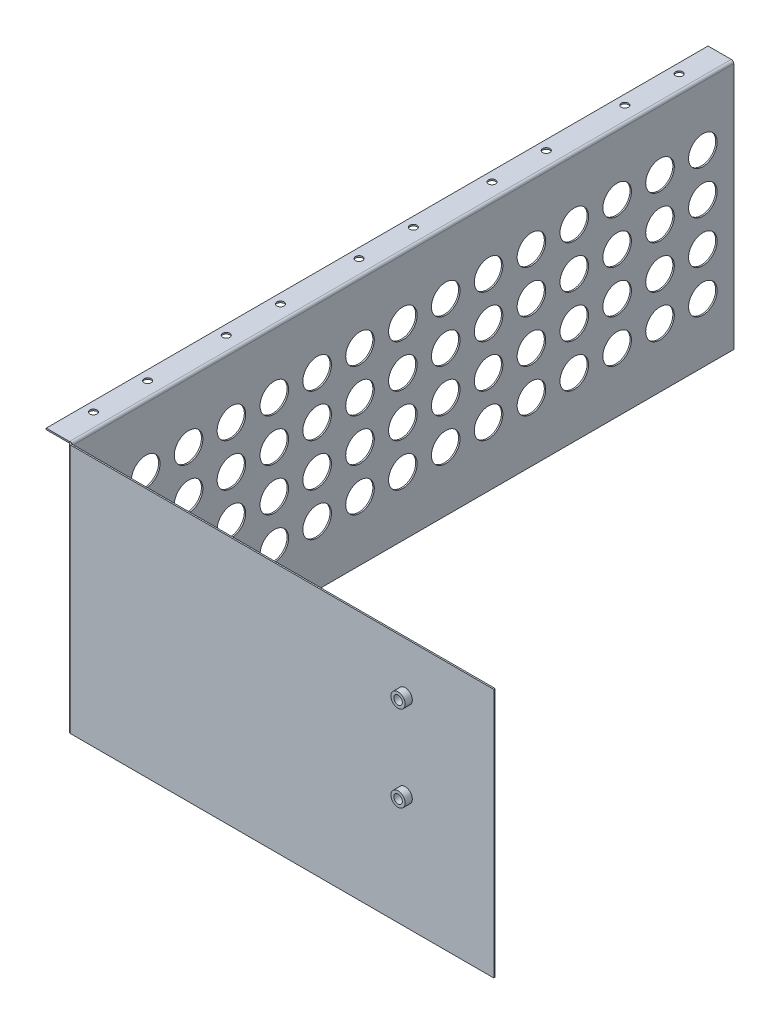
from build123d import *

# Parameters (mm, degrees)
SKETCH1_W                    = 298
SKETCH1_H                    = 175
BASE_FLANGE1_DEPTH           = 1
EDGE_FLANGE1_STRIP_W         = 5.4732
EDGE_FLANGE1_STRIP_H         = 1
EDGE_FLANGE1_STRIP_CUT_DEPTH = 175
EDGE_FLANGE1_DEPTH           = 175
EDGE_FLANGE2_STRIP_W         = 5.4732
EDGE_FLANGE2_STRIP_H         = 1
EDGE_FLANGE2_STRIP_CUT_DEPTH = 463.2634
EDGE_FLANGE2_DEPTH           = 463.2634
SKETCH21_R                   = 5
SKETCH21_R_2                 = 3
BOSS_EXTRUDE2_DEPTH          = 5
SKETCH22_R                   = 10
CUT_EXTRUDE1_DEPTH           = 10
SKETCH24_R                   = 2.5
CUT_EXTRUDE2_DEPTH           = 1


# Sheet-metal steps are written as plain solids
with BuildPart() as part:
    # Sketch1 → Base-Flange1 (new body)
    with BuildSketch(Plane.XY):
        Rectangle(SKETCH1_W, SKETCH1_H)
    extrude(amount=-BASE_FLANGE1_DEPTH)

    # Edge-Flange1 strip (across the edge) → Edge-Flange1 strip cut (cut)
    with BuildSketch(Plane(origin=(-149, -87.5, -1), x_dir=(1, 0, 0), z_dir=(0, 1, 0))):
        with Locations((-1, -0.5)):
            Rectangle(EDGE_FLANGE1_STRIP_W, EDGE_FLANGE1_STRIP_H)
    extrude(amount=EDGE_FLANGE1_STRIP_CUT_DEPTH, mode=Mode.SUBTRACT)

    # Edge-Flange1 section (across the edge) → Edge-Flange1 (add)
    with BuildSketch(Plane(origin=(-149, -87.5, -1), x_dir=(1, 0, 0), z_dir=(0, 1, 0))):
        with BuildLine():
            Line((0, 0.7366), (0, 464))
            Line((0, 464), (1, 464))
            Line((1, 464), (1, 0.7366))
            ThreePointArc((1, 0.7366), (1.215745145, 0.215745145), (1.7366, 0))
            Line((1.7366, 0), (1.7366, -1))
            ThreePointArc((1.7366, -1), (0.508638364, -0.491361636), (0, 0.7366))
        make_face()
    extrude(amount=EDGE_FLANGE1_DEPTH)

    # Edge-Flange2 strip (across the edge) → Edge-Flange2 strip cut (cut)
    with BuildSketch(Plane(origin=(-149, 87.5, -1.7366), x_dir=(0, -1, 0), z_dir=(0, 0, -1))):
        with Locations((-1, -0.5)):
            Rectangle(EDGE_FLANGE2_STRIP_W, EDGE_FLANGE2_STRIP_H)
    extrude(amount=EDGE_FLANGE2_STRIP_CUT_DEPTH, mode=Mode.SUBTRACT)

    # Edge-Flange2 section (across the edge) → Edge-Flange2 (add)
    with BuildSketch(Plane(origin=(-149, 87.5, -1.7366), x_dir=(0, -1, 0), z_dir=(0, 0, -1))):
        with BuildLine():
            Line((0, 0.7366), (0, 17))
            Line((0, 17), (1, 17))
            Line((1, 17), (1, 0.7366))
            ThreePointArc((1, 0.7366), (1.215745145, 0.215745145), (1.7366, 0))
            Line((1.7366, 0), (1.7366, -1))
            ThreePointArc((1.7366, -1), (0.508638364, -0.491361636), (0, 0.7366))
        make_face()
    extrude(amount=EDGE_FLANGE2_DEPTH)

    # Sketch21 → Boss-Extrude2 (add)
    # profile 1 of 2: a face of its own
    with BuildSketch(Plane.XY):
        with Locations(Location((87, 52.5, 0), (0, 0, 180))):
            Circle(SKETCH21_R)
        with Locations((87, 52.5)):
            Circle(SKETCH21_R_2, mode=Mode.SUBTRACT)
    # profile 2 of 2: a face of its own
    with BuildSketch(Plane.XY):
        with Locations(Location((87, -7.5, 0), (0, 0, 180))):
            Circle(SKETCH21_R)
        with Locations((87, -7.5)):
            Circle(SKETCH21_R_2, mode=Mode.SUBTRACT)
    extrude(amount=BOSS_EXTRUDE2_DEPTH)

    # Sketch22 → Cut-Extrude1 (cut)
    with BuildSketch(Plane.ZY.offset(149)):
        with Locations((-443.375, 44.1334)):
            Circle(SKETCH22_R)
        with Locations((-413.375, 44.1334)):
            Circle(SKETCH22_R)
        with Locations((-383.375, 44.1334)):
            Circle(SKETCH22_R)
        with Locations((-353.375, 44.1334)):
            Circle(SKETCH22_R)
        with Locations((-323.375, 44.1334)):
            Circle(SKETCH22_R)
        with Locations((-293.375, 44.1334)):
            Circle(SKETCH22_R)
        with Locations((-263.375, 44.1334)):
            Circle(SKETCH22_R)
        with Locations((-233.375, 44.1334)):
            Circle(SKETCH22_R)
        with Locations((-203.375, 44.1334)):
            Circle(SKETCH22_R)
        with Locations((-173.375, 44.1334)):
            Circle(SKETCH22_R)
        with Locations((-143.375, 44.1334)):
            Circle(SKETCH22_R)
        with Locations((-113.375, 44.1334)):
            Circle(SKETCH22_R)
        with Locations((-83.375, 44.1334)):
            Circle(SKETCH22_R)
        with Locations((-413.375, 14.1334)):
            Circle(SKETCH22_R)
        with Locations((-383.375, 14.1334)):
            Circle(SKETCH22_R)
        with Locations((-353.375, 14.1334)):
            Circle(SKETCH22_R)
        with Locations((-323.375, 14.1334)):
            Circle(SKETCH22_R)
        with Locations((-293.375, 14.1334)):
            Circle(SKETCH22_R)
        with Locations((-263.375, 14.1334)):
            Circle(SKETCH22_R)
        with Locations((-233.375, 14.1334)):
            Circle(SKETCH22_R)
        with Locations((-203.375, 14.1334)):
            Circle(SKETCH22_R)
        with Locations((-173.375, 14.1334)):
            Circle(SKETCH22_R)
        with Locations((-143.375, 14.1334)):
            Circle(SKETCH22_R)
        with Locations((-113.375, 14.1334)):
            Circle(SKETCH22_R)
        with Locations((-83.375, 14.1334)):
            Circle(SKETCH22_R)
        with Locations((-413.375, -15.8666)):
            Circle(SKETCH22_R)
        with Locations((-383.375, -15.8666)):
            Circle(SKETCH22_R)
        with Locations((-353.375, -15.8666)):
            Circle(SKETCH22_R)
        with Locations((-323.375, -15.8666)):
            Circle(SKETCH22_R)
        with Locations((-293.375, -15.8666)):
            Circle(SKETCH22_R)
        with Locations((-263.375, -15.8666)):
            Circle(SKETCH22_R)
        with Locations((-233.375, -15.8666)):
            Circle(SKETCH22_R)
        with Locations((-203.375, -15.8666)):
            Circle(SKETCH22_R)
        with Locations((-173.375, -15.8666)):
            Circle(SKETCH22_R)
        with Locations((-143.375, -15.8666)):
            Circle(SKETCH22_R)
        with Locations((-113.375, -15.8666)):
            Circle(SKETCH22_R)
        with Locations((-83.375, -15.8666)):
            Circle(SKETCH22_R)
        with Locations((-413.375, -45.8666)):
            Circle(SKETCH22_R)
        with Locations((-383.375, -45.8666)):
            Circle(SKETCH22_R)
        with Locations((-353.375, -45.8666)):
            Circle(SKETCH22_R)
        with Locations((-323.375, -45.8666)):
            Circle(SKETCH22_R)
        with Locations((-293.375, -45.8666)):
            Circle(SKETCH22_R)
        with Locations((-263.375, -45.8666)):
            Circle(SKETCH22_R)
        with Locations((-233.375, -45.8666)):
            Circle(SKETCH22_R)
        with Locations((-203.375, -45.8666)):
            Circle(SKETCH22_R)
        with Locations((-173.375, -45.8666)):
            Circle(SKETCH22_R)
        with Locations((-143.375, -45.8666)):
            Circle(SKETCH22_R)
        with Locations((-113.375, -45.8666)):
            Circle(SKETCH22_R)
        with Locations((-83.375, -45.8666)):
            Circle(SKETCH22_R)
        with Locations((-443.375, 14.1334)):
            Circle(SKETCH22_R)
        with Locations((-443.375, -15.8666)):
            Circle(SKETCH22_R)
        with Locations((-443.375, -45.8666)):
            Circle(SKETCH22_R)
        with Locations((-53.375, 44.1334)):
            Circle(SKETCH22_R)
        with Locations((-23.375, 44.1334)):
            Circle(SKETCH22_R)
        with Locations((-53.375, 14.1334)):
            Circle(SKETCH22_R)
        with Locations((-23.375, 14.1334)):
            Circle(SKETCH22_R)
        with Locations((-53.375, -15.8666)):
            Circle(SKETCH22_R)
        with Locations((-23.375, -15.8666)):
            Circle(SKETCH22_R)
        with Locations((-53.375, -45.8666)):
            Circle(SKETCH22_R)
        with Locations((-23.375, -45.8666)):
            Circle(SKETCH22_R)
    extrude(amount=-CUT_EXTRUDE1_DEPTH, mode=Mode.SUBTRACT)

    # Sketch24 → Cut-Extrude2 (cut)
    with BuildSketch(Plane(origin=(0, 87.5, 0), x_dir=(1, 0, 0), z_dir=(0, 1, 0))):
        with Locations(Location((-159.25, 438, 0), (0, 0, 180))):
            Circle(SKETCH24_R)
        with Locations(Location((-159.25, 400, 0), (0, 0, 180))):
            Circle(SKETCH24_R)
        with Locations(Location((-159.25, 345, 0), (0, 0, 180))):
            Circle(SKETCH24_R)
        with Locations(Location((-159.25, 307, 0), (0, 0, 180))):
            Circle(SKETCH24_R)
        with Locations(Location((-159.25, 252, 0), (0, 0, 180))):
            Circle(SKETCH24_R)
        with Locations(Location((-159.25, 214, 0), (0, 0, 180))):
            Circle(SKETCH24_R)
        with Locations(Location((-159.25, 159, 0), (0, 0, 180))):
            Circle(SKETCH24_R)
        with Locations(Location((-159.25, 121, 0), (0, 0, 180))):
            Circle(SKETCH24_R)
        with Locations(Location((-159.25, 66, 0), (0, 0, 180))):
            Circle(SKETCH24_R)
        with Locations(Location((-159.25, 28, 0), (0, 0, 180))):
            Circle(SKETCH24_R)
    extrude(amount=-CUT_EXTRUDE2_DEPTH, mode=Mode.SUBTRACT)


solid = part.part
